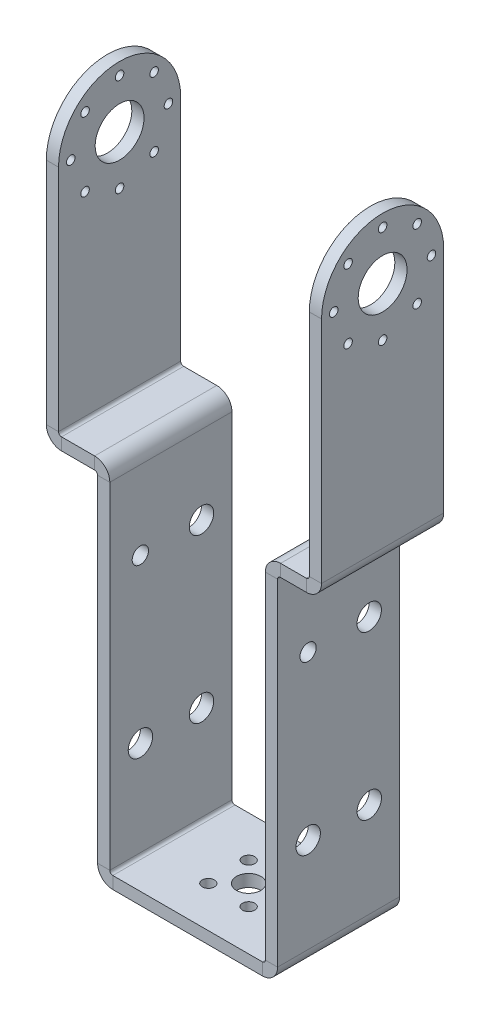
from build123d import *

# Parameters (mm, degrees)
SKETCH_1_W                       = 44.2
SKETCH_1_H                       = 30
SM_BASE_FLANGE_1_DEPTH           = 3
SM_EDGE_FLANGE_1_STRIP_W         = 13.4732
SM_EDGE_FLANGE_1_STRIP_H         = 3
SM_EDGE_FLANGE_1_STRIP_CUT_DEPTH = 30
SM_EDGE_FLANGE_1_DEPTH           = 30
SM_EDGE_FLANGE_2_STRIP_W         = 13.4732
SM_EDGE_FLANGE_2_STRIP_H         = 3
SM_EDGE_FLANGE_2_STRIP_CUT_DEPTH = 30
SM_EDGE_FLANGE_2_DEPTH           = 30
SM_EDGE_FLANGE_3_STRIP_W         = 13.4732
SM_EDGE_FLANGE_3_STRIP_H         = 3
SM_EDGE_FLANGE_3_STRIP_CUT_DEPTH = 30
SM_EDGE_FLANGE_3_DEPTH           = 30
SM_EDGE_FLANGE_4_STRIP_W         = 13.4732
SM_EDGE_FLANGE_4_STRIP_H         = 3
SM_EDGE_FLANGE_4_STRIP_CUT_DEPTH = 30
SM_EDGE_FLANGE_4_DEPTH           = 30
SM_EDGE_FLANGE_5_STRIP_W         = 13.4732
SM_EDGE_FLANGE_5_STRIP_H         = 3
SM_EDGE_FLANGE_5_STRIP_CUT_DEPTH = 30
SM_EDGE_FLANGE_5_DEPTH           = 30
SM_EDGE_FLANGE_6_STRIP_W         = 13.4732
SM_EDGE_FLANGE_6_STRIP_H         = 3
SM_EDGE_FLANGE_6_STRIP_CUT_DEPTH = 30
SM_EDGE_FLANGE_6_DEPTH           = 30
SKETCH_20_R                      = 6
SKETCH_20_R_2                    = 1.05
CUT_EXTRUDE_1_DEPTH              = 100
SKETCH_21_R                      = 3
SKETCH_21_R_2                    = 1.5
CUT_EXTRUDE_2_DEPTH              = 10
SKETCH_22_R                      = 3
CUT_EXTRUDE_3_DEPTH              = 66


# Sheet-metal steps are written as plain solids
with BuildPart() as part:
    # Sketch 1 → 基体-法兰1 (new body)
    with BuildSketch(Plane(origin=(0, 0, 0), x_dir=(1, 0, 0), z_dir=(0, 1, 0))):
        with Locations((-33.5, 16.21342484)):
            Rectangle(SKETCH_1_W, SKETCH_1_H)
    extrude(amount=-SM_BASE_FLANGE_1_DEPTH)

    # 边线-法兰1 strip (across the edge) → 边线-法兰1 strip cut (cut)
    with BuildSketch(Plane(origin=(-55.6, 0, -31.21342484), x_dir=(1, 0, 0), z_dir=(0, 0, 1))):
        with Locations((-3, -1.5)):
            Rectangle(SM_EDGE_FLANGE_1_STRIP_W, SM_EDGE_FLANGE_1_STRIP_H)
    extrude(amount=SM_EDGE_FLANGE_1_STRIP_CUT_DEPTH, mode=Mode.SUBTRACT)

    # 边线-法兰1 section (across the edge) → 边线-法兰1 (add)
    with BuildSketch(Plane(origin=(-55.6, 0, -31.21342484), x_dir=(1, 0, 0), z_dir=(0, 0, 1))):
        with BuildLine():
            Line((0, 0.7366), (0, 87))
            Line((0, 87), (3, 87))
            Line((3, 87), (3, 0.7366))
            ThreePointArc((3, 0.7366), (3.215745145, 0.215745145), (3.7366, 0))
            Line((3.7366, 0), (3.7366, -3))
            ThreePointArc((3.7366, -3), (1.094424801, -1.905575199), (0, 0.7366))
        make_face()
    extrude(amount=SM_EDGE_FLANGE_1_DEPTH)

    # 边线-法兰2 strip (across the edge) → 边线-法兰2 strip cut (cut)
    with BuildSketch(Plane(origin=(-11.4, 0, -1.21342484), x_dir=(-1, 0, 0), z_dir=(0, 0, -1))):
        with Locations((-3, -1.5)):
            Rectangle(SM_EDGE_FLANGE_2_STRIP_W, SM_EDGE_FLANGE_2_STRIP_H)
    extrude(amount=SM_EDGE_FLANGE_2_STRIP_CUT_DEPTH, mode=Mode.SUBTRACT)

    # 边线-法兰2 section (across the edge) → 边线-法兰2 (add)
    with BuildSketch(Plane(origin=(-11.4, 0, -1.21342484), x_dir=(-1, 0, 0), z_dir=(0, 0, -1))):
        with BuildLine():
            Line((0, 0.7366), (0, 87))
            Line((0, 87), (3, 87))
            Line((3, 87), (3, 0.7366))
            ThreePointArc((3, 0.7366), (3.215745145, 0.215745145), (3.7366, 0))
            Line((3.7366, 0), (3.7366, -3))
            ThreePointArc((3.7366, -3), (1.094424801, -1.905575199), (0, 0.7366))
        make_face()
    extrude(amount=SM_EDGE_FLANGE_2_DEPTH)

    # 边线-法兰3 strip (across the edge) → 边线-法兰3 strip cut (cut)
    with BuildSketch(Plane(origin=(-11.4, 87, -31.21342484), x_dir=(0, -1, 0), z_dir=(0, 0, 1))):
        with Locations((-3, -1.5)):
            Rectangle(SM_EDGE_FLANGE_3_STRIP_W, SM_EDGE_FLANGE_3_STRIP_H)
    extrude(amount=SM_EDGE_FLANGE_3_STRIP_CUT_DEPTH, mode=Mode.SUBTRACT)

    # 边线-法兰3 section (across the edge) → 边线-法兰3 (add)
    with BuildSketch(Plane(origin=(-11.4, 87, -31.21342484), x_dir=(0, -1, 0), z_dir=(0, 0, 1))):
        with BuildLine():
            Line((0, 0.7366), (0, 10.8))
            Line((0, 10.8), (3, 10.8))
            Line((3, 10.8), (3, 0.7366))
            ThreePointArc((3, 0.7366), (3.215745145, 0.215745145), (3.7366, 0))
            Line((3.7366, 0), (3.7366, -3))
            ThreePointArc((3.7366, -3), (1.094424801, -1.905575199), (0, 0.7366))
        make_face()
    extrude(amount=SM_EDGE_FLANGE_3_DEPTH)

    # 边线-法兰4 strip (across the edge) → 边线-法兰4 strip cut (cut)
    with BuildSketch(Plane(origin=(-55.6, 87, -1.21342484), x_dir=(0, -1, 0), z_dir=(0, 0, -1))):
        with Locations((-3, -1.5)):
            Rectangle(SM_EDGE_FLANGE_4_STRIP_W, SM_EDGE_FLANGE_4_STRIP_H)
    extrude(amount=SM_EDGE_FLANGE_4_STRIP_CUT_DEPTH, mode=Mode.SUBTRACT)

    # 边线-法兰4 section (across the edge) → 边线-法兰4 (add)
    with BuildSketch(Plane(origin=(-55.6, 87, -1.21342484), x_dir=(0, -1, 0), z_dir=(0, 0, -1))):
        with BuildLine():
            Line((0, 0.7366), (0, 12.6))
            Line((0, 12.6), (3, 12.6))
            Line((3, 12.6), (3, 0.7366))
            ThreePointArc((3, 0.7366), (3.215745145, 0.215745145), (3.7366, 0))
            Line((3.7366, 0), (3.7366, -3))
            ThreePointArc((3.7366, -3), (1.094424801, -1.905575199), (0, 0.7366))
        make_face()
    extrude(amount=SM_EDGE_FLANGE_4_DEPTH)

    # 边线-法兰5 strip (across the edge) → 边线-法兰5 strip cut (cut)
    with BuildSketch(Plane(origin=(-68.2, 87, -31.21342484), x_dir=(1, 0, 0), z_dir=(0, 0, 1))):
        with Locations((-3, -1.5)):
            Rectangle(SM_EDGE_FLANGE_5_STRIP_W, SM_EDGE_FLANGE_5_STRIP_H)
    extrude(amount=SM_EDGE_FLANGE_5_STRIP_CUT_DEPTH, mode=Mode.SUBTRACT)

    # 边线-法兰5 section (across the edge) → 边线-法兰5 (add)
    with BuildSketch(Plane(origin=(-68.2, 87, -31.21342484), x_dir=(1, 0, 0), z_dir=(0, 0, 1))):
        with BuildLine():
            Line((0, 0.7366), (0, 72))
            Line((0, 72), (3, 72))
            Line((3, 72), (3, 0.7366))
            ThreePointArc((3, 0.7366), (3.215745145, 0.215745145), (3.7366, 0))
            Line((3.7366, 0), (3.7366, -3))
            ThreePointArc((3.7366, -3), (1.094424801, -1.905575199), (0, 0.7366))
        make_face()
    extrude(amount=SM_EDGE_FLANGE_5_DEPTH)

    # 边线-法兰6 strip (across the edge) → 边线-法兰6 strip cut (cut)
    with BuildSketch(Plane(origin=(-0.6, 87, -1.21342484), x_dir=(-1, 0, 0), z_dir=(0, 0, -1))):
        with Locations((-3, -1.5)):
            Rectangle(SM_EDGE_FLANGE_6_STRIP_W, SM_EDGE_FLANGE_6_STRIP_H)
    extrude(amount=SM_EDGE_FLANGE_6_STRIP_CUT_DEPTH, mode=Mode.SUBTRACT)

    # 边线-法兰6 section (across the edge) → 边线-法兰6 (add)
    with BuildSketch(Plane(origin=(-0.6, 87, -1.21342484), x_dir=(-1, 0, 0), z_dir=(0, 0, -1))):
        with BuildLine():
            Line((0, 0.7366), (0, 72))
            Line((0, 72), (3, 72))
            Line((3, 72), (3, 0.7366))
            ThreePointArc((3, 0.7366), (3.215745145, 0.215745145), (3.7366, 0))
            Line((3.7366, 0), (3.7366, -3))
            ThreePointArc((3.7366, -3), (1.094424801, -1.905575199), (0, 0.7366))
        make_face()
    extrude(amount=SM_EDGE_FLANGE_6_DEPTH)

    # 草图20 → 切除-拉伸1 (cut)
    with BuildSketch(Plane(origin=(-0.6, 0, 0), x_dir=(0, 0, -1), z_dir=(1, 0, 0))):
        with Locations(Location((16.21342484, 144, 0), (0, 0, 90))):
            Circle(SKETCH_20_R)
        with Locations(Location((16.21342484, 156, 0), (0, 0, 90))):
            Circle(SKETCH_20_R_2)
        with BuildLine():
            ThreePointArc((1.21342484, 144), (5.606823122, 154.606601718), (16.21342484, 159))
            Line((16.21342484, 159), (1.21342484, 159))
            Line((1.21342484, 159), (1.21342484, 144))
        make_face()
        with BuildLine():
            Line((31.21342484, 159), (16.21342484, 159))
            ThreePointArc((16.21342484, 159), (26.820026558, 154.606601718), (31.21342484, 144))
            Line((31.21342484, 144), (31.21342484, 159))
        make_face()
        with Locations(Location((24.698706214, 152.485281374, 0), (0, 0, 90))):
            Circle(SKETCH_20_R_2)
        with Locations(Location((28.21342484, 144, 0), (0, 0, 90))):
            Circle(SKETCH_20_R_2)
        with Locations(Location((24.698706214, 135.514718626, 0), (0, 0, 90))):
            Circle(SKETCH_20_R_2)
        with Locations(Location((16.21342484, 132, 0), (0, 0, 90))):
            Circle(SKETCH_20_R_2)
        with Locations(Location((7.728143465, 135.514718626, 0), (0, 0, 90))):
            Circle(SKETCH_20_R_2)
        with Locations(Location((4.21342484, 144, 0), (0, 0, 90))):
            Circle(SKETCH_20_R_2)
        with Locations(Location((7.728143465, 152.485281374, 0), (0, 0, 90))):
            Circle(SKETCH_20_R_2)
    extrude(amount=-CUT_EXTRUDE_1_DEPTH, mode=Mode.SUBTRACT)

    # 草图21 → 切除-拉伸2 (cut)
    with BuildSketch(Plane.XZ.offset(3)):
        with Locations(Location((-33.5, -16.21342484, 0), (0, 0, 270))):
            Circle(SKETCH_21_R)
        with Locations(Location((-28.550252532, -11.263677371, 0), (0, 0, 270))):
            Circle(SKETCH_21_R_2)
        with Locations(Location((-28.550252532, -21.163172308, 0), (0, 0, 270))):
            Circle(SKETCH_21_R_2)
        with Locations(Location((-38.449747468, -21.163172308, 0), (0, 0, 270))):
            Circle(SKETCH_21_R_2)
        with Locations(Location((-38.449747468, -11.263677371, 0), (0, 0, 270))):
            Circle(SKETCH_21_R_2)
    extrude(amount=-CUT_EXTRUDE_2_DEPTH, mode=Mode.SUBTRACT)

    # 草图22 → 切除-拉伸3 (cut)
    with BuildSketch(Plane(origin=(-11.4, 0, 0), x_dir=(0, 0, -1), z_dir=(1, 0, 0))):
        with BuildLine():
            ThreePointArc((10.708105598, 63.997198238), (7.293172758, 65.40967406), (8.709123695, 61.996180659))
            Line((8.709123695, 61.996180659), (8.708105857, 63.9961804))
            Line((8.708105857, 63.9961804), (10.708105598, 63.997198238))
        make_face()
        with BuildLine():
            Line((8.708105857, 63.9961804), (8.709123695, 61.996180659))
            ThreePointArc((8.709123695, 61.996180659), (10.122679234, 62.582326744), (10.708105857, 63.9961804))
            ThreePointArc((10.708105857, 63.9961804), (10.708105793, 63.996689319), (10.708105598, 63.997198238))
            Line((10.708105598, 63.997198238), (8.708105857, 63.9961804))
        make_face()
        with Locations(Location((23.739100582, 24.0038196, 0), (0, 0, 90))):
            Circle(SKETCH_22_R)
        with Locations(Location((8.72845873, 24.0038196, 0), (0, 0, 90))):
            Circle(SKETCH_22_R)
        with Locations(Location((23.718743822, 64.0038196, 0), (0, 0, 90))):
            Circle(SKETCH_22_R)
    extrude(amount=-CUT_EXTRUDE_3_DEPTH, mode=Mode.SUBTRACT)


solid = part.part
